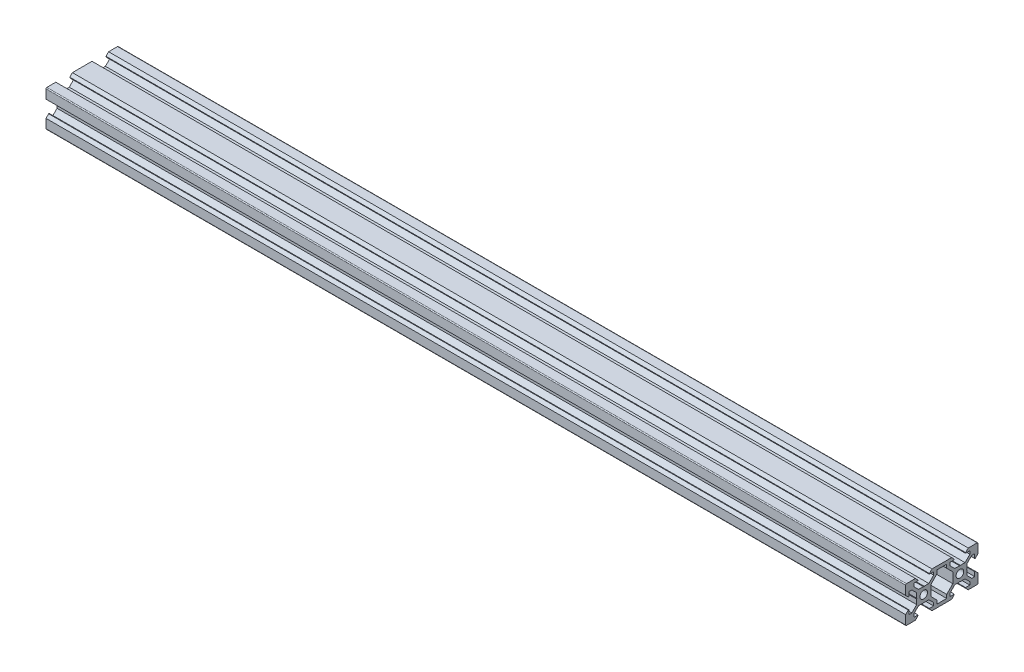
from build123d import *

# Parameters (mm, degrees)
PROFILE_SKETCH_R      = 2.1
PROFILE_EXTRUDE_DEPTH = 475


with BuildPart() as part:
    # Profile Sketch → Profile Extrude (new body)
    with BuildSketch(Plane(origin=(0, 0, 0), x_dir=(0, 0, -1), z_dir=(1, 0, 0))):
        with BuildLine():
            Line((6.875, 8.545), (5.42, 10))
            Line((5.42, 10), (-5.42, 10))
            Line((-5.42, 10), (-6.875, 8.545))
            Line((-6.875, 8.545), (-6.875, 8.2))
            Line((-6.875, 8.2), (-4.5, 8.2))
            Line((-4.5, 8.2), (-4.5, 6.56))
            Line((-4.5, 6.56), (-7.16, 3.9))
            Line((-7.16, 3.9), (-9.79, 3.9))
            Line((-9.79, 3.9), (-10, 3.69))
            Line((-10, 3.69), (-10.21, 3.9))
            Line((-10.21, 3.9), (-12.84, 3.9))
            Line((-12.84, 3.9), (-15.5, 6.56))
            Line((-15.5, 6.56), (-15.5, 8.2))
            Line((-15.5, 8.2), (-13.125, 8.2))
            Line((-13.125, 8.2), (-13.125, 8.545))
            Line((-13.125, 8.545), (-14.58, 10))
            Line((-14.58, 10), (-19.5, 10))
            ThreePointArc((-19.5, 10), (-19.853553391, 9.853553391), (-20, 9.5))
            Line((-20, 9.5), (-20, 4.58))
            Line((-20, 4.58), (-18.545, 3.125))
            Line((-18.545, 3.125), (-18.2, 3.125))
            Line((-18.2, 3.125), (-18.2, 5.5))
            Line((-18.2, 5.5), (-16.56, 5.5))
            Line((-16.56, 5.5), (-13.9, 2.838679656))
            Line((-13.9, 2.838679656), (-13.9, 0.21))
            Line((-13.9, 0.21), (-13.69, 0))
            Line((-13.69, 0), (-13.9, -0.21))
            Line((-13.9, -0.21), (-13.9, -2.838679656))
            Line((-13.9, -2.838679656), (-16.56, -5.5))
            Line((-16.56, -5.5), (-18.2, -5.5))
            Line((-18.2, -5.5), (-18.2, -3.125))
            Line((-18.2, -3.125), (-18.545, -3.125))
            Line((-18.545, -3.125), (-20, -4.58))
            Line((-20, -4.58), (-20, -9.5))
            ThreePointArc((-20, -9.5), (-19.853553391, -9.853553391), (-19.5, -10))
            Line((-19.5, -10), (-14.58, -10))
            Line((-14.58, -10), (-13.125, -8.545))
            Line((-13.125, -8.545), (-13.125, -8.2))
            Line((-13.125, -8.2), (-15.5, -8.2))
            Line((-15.5, -8.2), (-15.5, -6.56))
            Line((-15.5, -6.56), (-12.84, -3.9))
            Line((-12.84, -3.9), (-10.21, -3.9))
            Line((-10.21, -3.9), (-10, -3.69))
            Line((-10, -3.69), (-9.79, -3.9))
            Line((-9.79, -3.9), (-7.16, -3.9))
            Line((-7.16, -3.9), (-4.5, -6.56))
            Line((-4.5, -6.56), (-4.5, -8.2))
            Line((-4.5, -8.2), (-6.875, -8.2))
            Line((-6.875, -8.2), (-6.875, -8.545))
            Line((-6.875, -8.545), (-5.42, -10))
            Line((-5.42, -10), (5.42, -10))
            Line((5.42, -10), (6.875, -8.545))
            Line((6.875, -8.545), (6.875, -8.2))
            Line((6.875, -8.2), (4.5, -8.2))
            Line((4.5, -8.2), (4.5, -6.56))
            Line((4.5, -6.56), (7.16, -3.9))
            Line((7.16, -3.9), (9.79, -3.9))
            Line((9.79, -3.9), (10, -3.69))
            Line((10, -3.69), (10.21, -3.9))
            Line((10.21, -3.9), (12.84, -3.9))
            Line((12.84, -3.9), (15.5, -6.56))
            Line((15.5, -6.56), (15.5, -8.2))
            Line((15.5, -8.2), (13.125, -8.2))
            Line((13.125, -8.2), (13.125, -8.545))
            Line((13.125, -8.545), (14.58, -10))
            Line((14.58, -10), (19.5, -10))
            ThreePointArc((19.5, -10), (19.853553391, -9.853553391), (20, -9.5))
            Line((20, -9.5), (20, -4.58))
            Line((20, -4.58), (18.545, -3.125))
            Line((18.545, -3.125), (18.2, -3.125))
            Line((18.2, -3.125), (18.2, -5.5))
            Line((18.2, -5.5), (16.56, -5.5))
            Line((16.56, -5.5), (13.9, -2.838679656))
            Line((13.9, -2.838679656), (13.9, -0.21))
            Line((13.9, -0.21), (13.69, 0))
            Line((13.69, 0), (13.9, 0.21))
            Line((13.9, 0.21), (13.9, 2.838679656))
            Line((13.9, 2.838679656), (16.56, 5.5))
            Line((16.56, 5.5), (18.2, 5.5))
            Line((18.2, 5.5), (18.2, 3.125))
            Line((18.2, 3.125), (18.545, 3.125))
            Line((18.545, 3.125), (20, 4.58))
            Line((20, 4.58), (20, 9.5))
            ThreePointArc((20, 9.5), (19.853553391, 9.853553391), (19.5, 10))
            Line((19.5, 10), (14.58, 10))
            Line((14.58, 10), (13.125, 8.545))
            Line((13.125, 8.545), (13.125, 8.2))
            Line((13.125, 8.2), (15.5, 8.2))
            Line((15.5, 8.2), (15.5, 6.56))
            Line((15.5, 6.56), (12.84, 3.9))
            Line((12.84, 3.9), (10.21, 3.9))
            Line((10.21, 3.9), (10, 3.69))
            Line((10, 3.69), (9.79, 3.9))
            Line((9.79, 3.9), (7.16, 3.9))
            Line((7.16, 3.9), (4.5, 6.56))
            Line((4.5, 6.56), (4.5, 8.2))
            Line((4.5, 8.2), (6.875, 8.2))
            Line((6.875, 8.2), (6.875, 8.545))
        make_face()
        with Locations((-10, 0)):
            Circle(PROFILE_SKETCH_R, mode=Mode.SUBTRACT)
        with Locations((10, 0)):
            Circle(PROFILE_SKETCH_R, mode=Mode.SUBTRACT)
        Polygon((-2.7, 8.2), (2.7, 8.2), (2.7, 6.238679656), (6.1, 2.838679656), (6.1, -0.21), (6.1, -2.838679656), (2.7, -6.238679656), (2.7, -8.2), (-2.7, -8.2), (-2.7, -6.238679656), (-6.1, -2.838679656), (-6.1, -0.21), (-6.1, 2.838679656), (-2.7, 6.238679656), align=None, mode=Mode.SUBTRACT)
    extrude(amount=PROFILE_EXTRUDE_DEPTH)


solid = part.part
